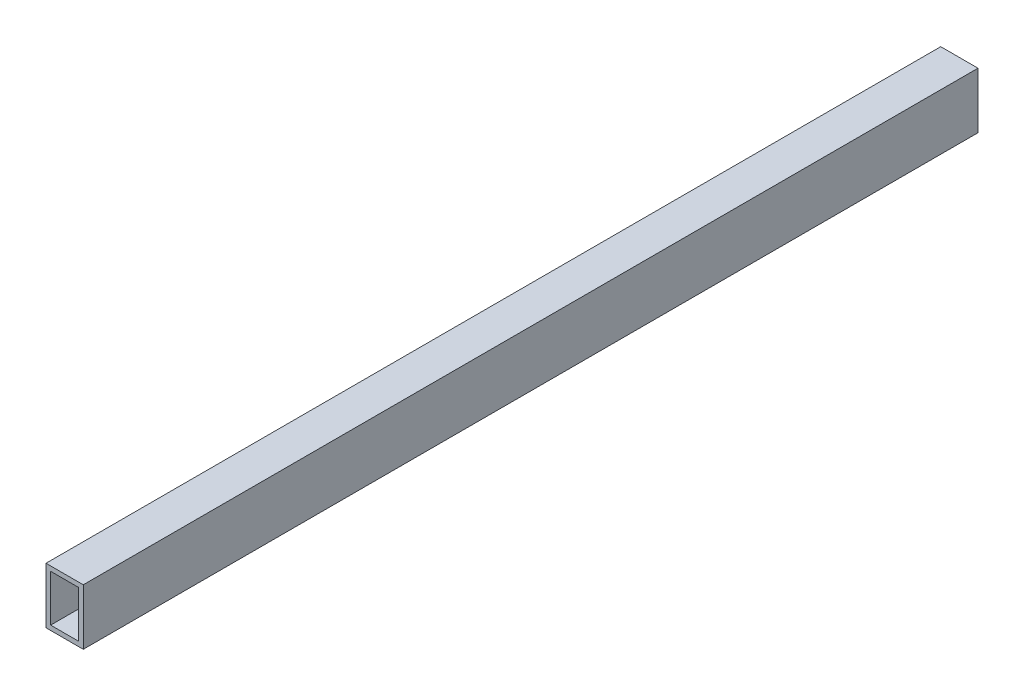
from build123d import *

# Parameters (mm, degrees)
SKETCH1_W           = 25.4
SKETCH1_H           = 38.1
BOSS_EXTRUDE1_DEPTH = 609.6
SHELL1_T            = -3.175


with BuildPart() as part:
    # Sketch1 → Boss-Extrude1 (new body)
    with BuildSketch(Plane.XY):
        Rectangle(SKETCH1_W, SKETCH1_H)
    extrude(amount=BOSS_EXTRUDE1_DEPTH)

    # Shell1
    shell1_openings = [part.faces().sort_by_distance(p)[0] for p in [
        (0, 0, 0),
        (0, 0, 609.6),
    ]]
    offset(amount=SHELL1_T, openings=shell1_openings, kind=Kind.INTERSECTION)


solid = part.part
